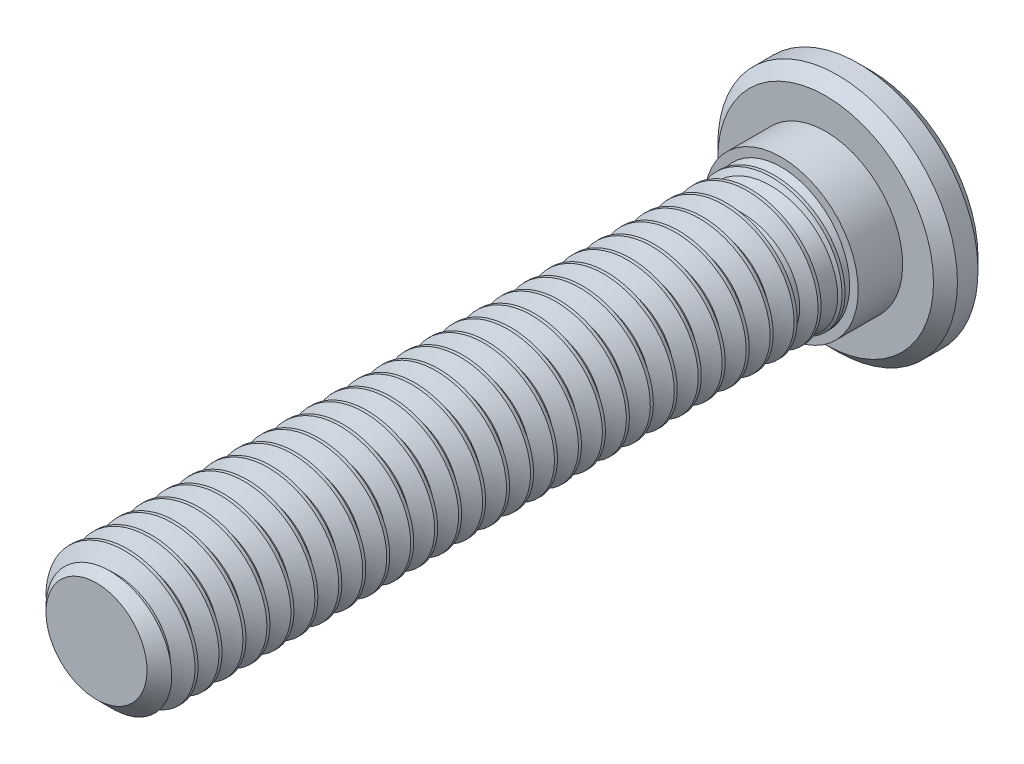
from build123d import *

# Parameters (mm, degrees)
CHAMFER2_SIZE       = 0.525
CUT_EXTRUDE1_DEPTH  = 1.875
CHAMFER1_SIZE       = 0.35
SKETCH11_R          = 2.25
BOSS_EXTRUDE1_DEPTH = 1.3
CUT_SWEEP1_PITCH    = 0.7
CUT_SWEEP1_TO       = 20
SKETCH12_R          = 2
BOSS_EXTRUDE2_DEPTH = 1.575
BOSS_EXTRUDE2_TAPER = 17


with BuildPart() as part:
    # Sketch13 → Revolve1 (revolve)
    with BuildSketch(Plane(origin=(0, 0, 0), x_dir=(0, 0, -1), z_dir=(1, 0, 0)), mode=Mode.PRIVATE) as revolve1_sk:
        Polygon((1.3, 3.5), (0, 3.5), (0, 2), (-21.3, 2), (-21.3, 0), (1.3, 0), align=None)
    revolve(revolve1_sk.sketch.rotate(Axis((0, 0, 21.3), (0, 0, -1)), 180), axis=Axis((0, 0, 21.3), (0, 0, -1)))

    # Chamfer2
    chamfer2_edges = [part.edges().sort_by_distance(p)[0] for p in [
        (0, 2, 21.3),
    ]]
    chamfer(chamfer2_edges, length=CHAMFER2_SIZE)

    # Sketch7 → Cut-Extrude1 (cut)
    with BuildSketch(Plane(origin=(0, 0, -1.3), x_dir=(-1, 0, 0), z_dir=(0, 0, -1))):
        Polygon((0, 1.443375673), (-1.25, 0.721687836), (-1.25, -0.721687836), (0, -1.443375673), (1.25, -0.721687836), (1.25, 0.721687836), align=None)
    extrude(amount=-CUT_EXTRUDE1_DEPTH, mode=Mode.SUBTRACT)

    # Chamfer1
    chamfer1_edges = [part.edges().sort_by_distance(p)[0] for p in [
        (0, 3.5, 0),
        (0, 3.5, -1.3),
    ]]
    chamfer(chamfer1_edges, length=CHAMFER1_SIZE)

    # Cut-Extrude2 cone 1 section (through the dimple's axis) → Cut-Extrude2 (revolve, cut)
    with BuildSketch(Plane(origin=(0, 0, -1.3), x_dir=(0, 1, 0), z_dir=(1, 0, 0))):
        Polygon((0, 0), (1.443375673, 0), (0, 1.443375673), align=None)
    revolve(axis=Axis((0, 0, -1.3), (0, 0, 1)), mode=Mode.SUBTRACT)

    # Sketch11 → Boss-Extrude1 (add)
    with BuildSketch(Plane.XY):
        with Locations(Location((0, 0, 0), (0, 0, 90))):
            Circle(SKETCH11_R)
    extrude(amount=BOSS_EXTRUDE1_DEPTH)


with BuildPart() as body_2:
    # Split1: read off the stored shape, not the designer's step
    # Split1: the piece on the far side of the plane
    add(part.part)
    split(bisect_by=Plane.XY.offset(1.3), keep=Keep.BOTTOM)


with BuildPart() as part_1:
    add(part.part)

    # Split1
    split(bisect_by=Plane.XY.offset(1.3), keep=Keep.TOP)

    # Cut-Sweep1: arcs per turn and ends read off the stored shape
    # Cut-Sweep1: the profile of Sketch3 screwed along a right-hand helix through 32 turns, 6 arcs to a turn; built about Z, then put on its axis
    cut_sweep1_z = Axis((0, 0, 0), (0, 0, 1))
    cut_sweep1_corners = [(2.037888611, 0, -0.634375), (2.037888611, 0, 0.021875), (1.545336663, 0, -0.2625), (1.545336663, 0, -0.35)]
    with BuildLine(mode=Mode.PRIVATE) as cut_sweep1_profile:
        Line(cut_sweep1_corners[0], cut_sweep1_corners[1])
        Line(cut_sweep1_corners[1], cut_sweep1_corners[2])
        Line(cut_sweep1_corners[2], cut_sweep1_corners[3])
        Line(cut_sweep1_corners[3], cut_sweep1_corners[0])
    cut_sweep1_cap = Face(cut_sweep1_profile.wire())
    cut_sweep1_turn_angles = [0, 30, 60, 90, 120, 150, 180, 210, 240, 270, 300, 330, 360]
    cut_sweep1_turn_weights = [1, 0.8660254037844387, 1, 0.8660254037844387, 1, 0.8660254037844387, 1, 0.8660254037844387, 1, 0.8660254037844387, 1, 0.8660254037844387, 1]
    cut_sweep1_turn_rails = [Edge.make_bspline([Vector(p[0], p[1], 0).rotate(cut_sweep1_z, cut_sweep1_turn_angles[k]) / cut_sweep1_turn_weights[k] + Vector(0, 0, p[2] + CUT_SWEEP1_PITCH * cut_sweep1_turn_angles[k] / 360) for k in range(13)], [0, 0, 0, 1, 1, 2, 2, 3, 3, 4, 4, 5, 5, 6, 6, 6], 2, cut_sweep1_turn_weights) for p in cut_sweep1_corners]
    cut_sweep1_turn_sides = [Face.make_surface_from_curves(cut_sweep1_turn_rails[p[0]], cut_sweep1_turn_rails[p[1]]) for p in [(0, 1), (1, 2), (2, 3), (3, 0)]]
    cut_sweep1 = Plane(origin=(0, 0, 21.3), x_dir=(0, 1, 0), z_dir=(0, 0, -1)) * split(Solid(Shell([*[p.moved(Location((0, 0, CUT_SWEEP1_PITCH * i))) for i in range(32) for p in cut_sweep1_turn_sides], cut_sweep1_cap, cut_sweep1_cap.rotate(cut_sweep1_z, 11520).moved(Location((0, 0, CUT_SWEEP1_PITCH * 11520 / 360)))])), bisect_by=Plane.XY.offset(CUT_SWEEP1_TO), keep=Keep.BOTTOM, mode=Mode.PRIVATE)
    add(cut_sweep1, mode=Mode.SUBTRACT)

    add(body_2.part)  # Boss-Extrude2 merges body 2
    # Sketch12 → Boss-Extrude2 (add)
    with BuildSketch(Plane.XY.offset(1.3)):
        Circle(SKETCH12_R)
    extrude(amount=BOSS_EXTRUDE2_DEPTH, taper=BOSS_EXTRUDE2_TAPER)


solid = part_1.part
